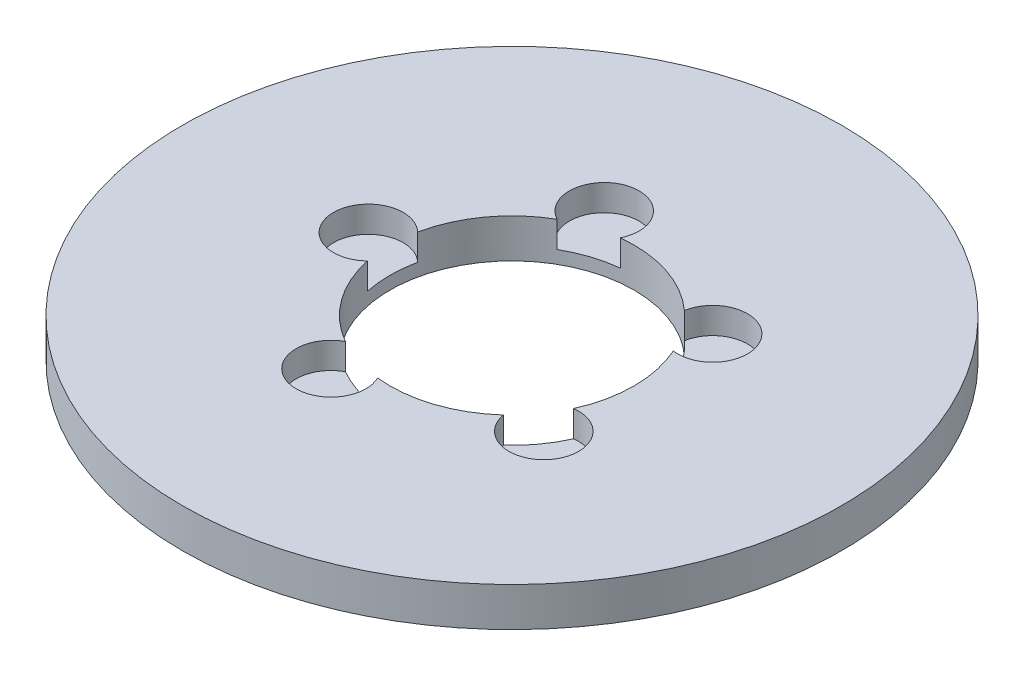
from build123d import *

# Parameters (mm, degrees)
SKETCH1_R           = 67.5
BOSS_EXTRUDE1_DEPTH = 8
SKETCH2_R           = 25
CUT_EXTRUDE1_DEPTH  = 96.79404992
SKETCH3_R           = 7.138417589
CUT_EXTRUDE2_DEPTH  = 5.366028914
CIRPATTERN1_COUNT   = 5


with BuildPart() as part:
    # Sketch1 → Boss-Extrude1 (new body)
    with BuildSketch(Plane(origin=(0, 0, 0), x_dir=(1, 0, 0), z_dir=(0, 1, 0))):
        Circle(SKETCH1_R)
    extrude(amount=BOSS_EXTRUDE1_DEPTH)

    # Sketch2 → Cut-Extrude1 (cut, through all)
    with BuildSketch(Plane(origin=(0, 0, 0), x_dir=(1, 0, 0), z_dir=(0, 1, 0))):
        Circle(SKETCH2_R)
    extrude(amount=CUT_EXTRUDE1_DEPTH, mode=Mode.SUBTRACT)

    # Sketch3 → Cut-Extrude2 (cut)
    with BuildSketch(Plane(origin=(0, 8, 0), x_dir=(1, 0, 0), z_dir=(0, 1, 0))):
        with Locations((-29.422094143, 0)):
            Circle(SKETCH3_R)
    cut_extrude2 = extrude(amount=-CUT_EXTRUDE2_DEPTH, mode=Mode.SUBTRACT)

    # CirPattern1: Cut-Extrude2 ×5 about axis
    cirpattern1_axis = Axis((0, 0, 0), (0, 1, 0))
    for i in range(1, CIRPATTERN1_COUNT):
        add(cut_extrude2.rotate(cirpattern1_axis, i * 360 / CIRPATTERN1_COUNT), mode=Mode.SUBTRACT)


solid = part.part
